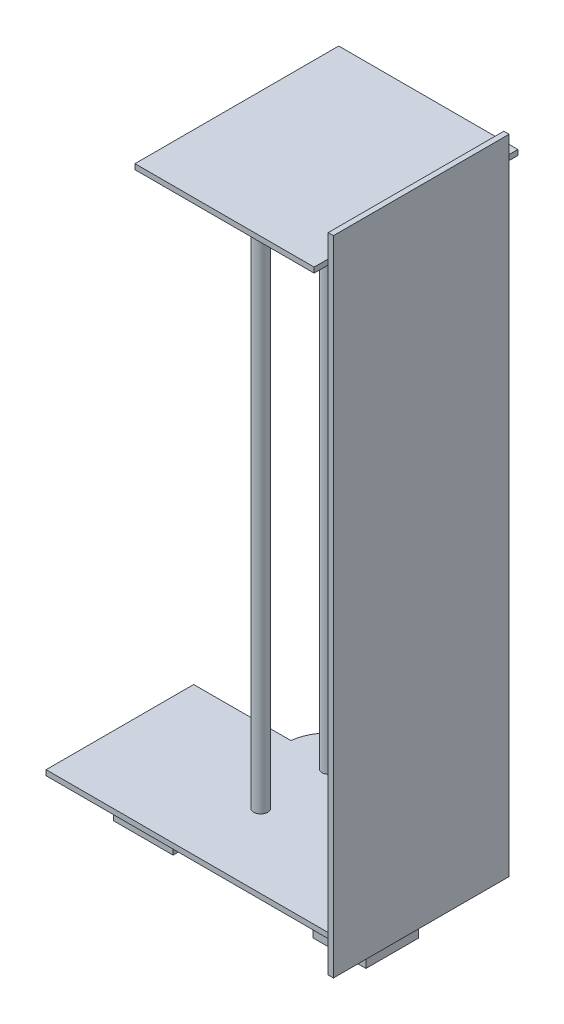
from build123d import *

# Parameters (mm, degrees)
SKETCH1_R                 = 4
BOSS_EXTRUDE1_DEPTH       = 3
SKETCH1_3_R               = 4
BOSS_EXTRUDE2_DEPTH       = 340
BOSS_EXTRUDE3_START       = -30
BOSS_EXTRUDE3_OUTLINE_W   = 34
BOSS_EXTRUDE3_OUTLINE_H   = 30
BOSS_EXTRUDE3_OUTLINE_R   = 4
BOSS_EXTRUDE3_OUTLINE_W_2 = 30
BOSS_EXTRUDE3_OUTLINE_H_2 = 30.979171587
BOSS_EXTRUDE3_DEPTH       = 30
SKETCH5_W                 = 100
SKETCH5_H                 = 366
BOSS_EXTRUDE4_DEPTH       = 3
SKETCH6_W                 = 102
SKETCH6_H                 = 116
BOSS_EXTRUDE6_DEPTH       = 3


# Read off the part's stored shape, not the designer's step: Boss-Extrude3
with BuildPart() as part:
    # Sketch1 → Boss-Extrude1 (new body)
    with BuildSketch(Plane(origin=(0, 0, 0), x_dir=(1, 0, 0), z_dir=(0, 1, 0))):
        with BuildLine():
            Line((0, 84), (0, 0))
            Line((0, 0), (168.5, 0))
            Line((168.5, 0), (168.5, 84.179067966))
            Line((168.5, 84.179067966), (104.941145125, 84.111522833))
            ThreePointArc((104.941145125, 84.111522833), (80.098432068, 106.08513446), (55.302478571, 84.058770934))
            Line((55.302478571, 84.058770934), (0, 84))
        make_face()
        with Locations(Location((80.125, 42.085148577, 0), (0, 0, 270))):
            Circle(SKETCH1_R, mode=Mode.SUBTRACT)
        with Locations(Location((80.125, 81.085148577, 0), (0, 0, 270))):
            Circle(SKETCH1_R, mode=Mode.SUBTRACT)
    extrude(amount=BOSS_EXTRUDE1_DEPTH)

    # Sketch1<3> → Boss-Extrude2 (add)
    with BuildSketch(Plane(origin=(0, 0, 0), x_dir=(1, 0, 0), z_dir=(0, 1, 0))):
        with BuildLine():
            ThreePointArc((82.767561665, 84.087958569), (80.120749131, 85.085146319), (77.476062031, 84.082335198))
            Line((77.476062031, 84.082335198), (82.767561665, 84.087958569))
        make_face()
        with BuildLine():
            Line((82.767561665, 84.087958569), (77.476062031, 84.082335198))
            ThreePointArc((77.476062031, 84.082335198), (78.481186123, 77.438523297), (84.125, 81.085148577))
            ThreePointArc((84.125, 81.085148577), (83.769876312, 82.732836858), (82.767561665, 84.087958569))
        make_face()
        with Locations(Location((80.125, 42.085148577, 0), (0, 0, 270))):
            Circle(SKETCH1_3_R)
    extrude(amount=BOSS_EXTRUDE2_DEPTH)

    # Boss-Extrude3 outline → Boss-Extrude3 (add)
    # profile 1 of 2: a face of its own
    with BuildSketch(Plane.XY.offset(-27).offset(BOSS_EXTRUDE3_START)):
        with Locations((28.275525376, -15)):
            Rectangle(BOSS_EXTRUDE3_OUTLINE_W, BOSS_EXTRUDE3_OUTLINE_H)
        with Locations((28.275525376, -15)):
            Circle(BOSS_EXTRUDE3_OUTLINE_R, mode=Mode.SUBTRACT)
    # profile 2 of 2: a face of its own
    with BuildSketch(Plane.XY.offset(-27).offset(BOSS_EXTRUDE3_START)):
        with Locations((140.075525376, -15.489585794)):
            Rectangle(BOSS_EXTRUDE3_OUTLINE_W_2, BOSS_EXTRUDE3_OUTLINE_H_2)
        with Locations((140.075525376, -21)):
            Circle(BOSS_EXTRUDE3_OUTLINE_R, mode=Mode.SUBTRACT)
    extrude(amount=BOSS_EXTRUDE3_DEPTH)

    # Sketch5 → Boss-Extrude4 (add)
    with BuildSketch(Plane(origin=(168.5, 0, 0), x_dir=(0, 0, -1), z_dir=(1, 0, 0))):
        with Locations((42.089533983, 173)):
            Rectangle(SKETCH5_W, SKETCH5_H)
    extrude(amount=BOSS_EXTRUDE4_DEPTH)

    # Sketch6 → Boss-Extrude6 (add)
    with BuildSketch(Plane(origin=(0, 340, 0), x_dir=(1, 0, 0), z_dir=(0, 1, 0))):
        with Locations((117.5, 42.085148577)):
            Rectangle(SKETCH6_W, SKETCH6_H)
    extrude(amount=BOSS_EXTRUDE6_DEPTH)


solid = part.part
